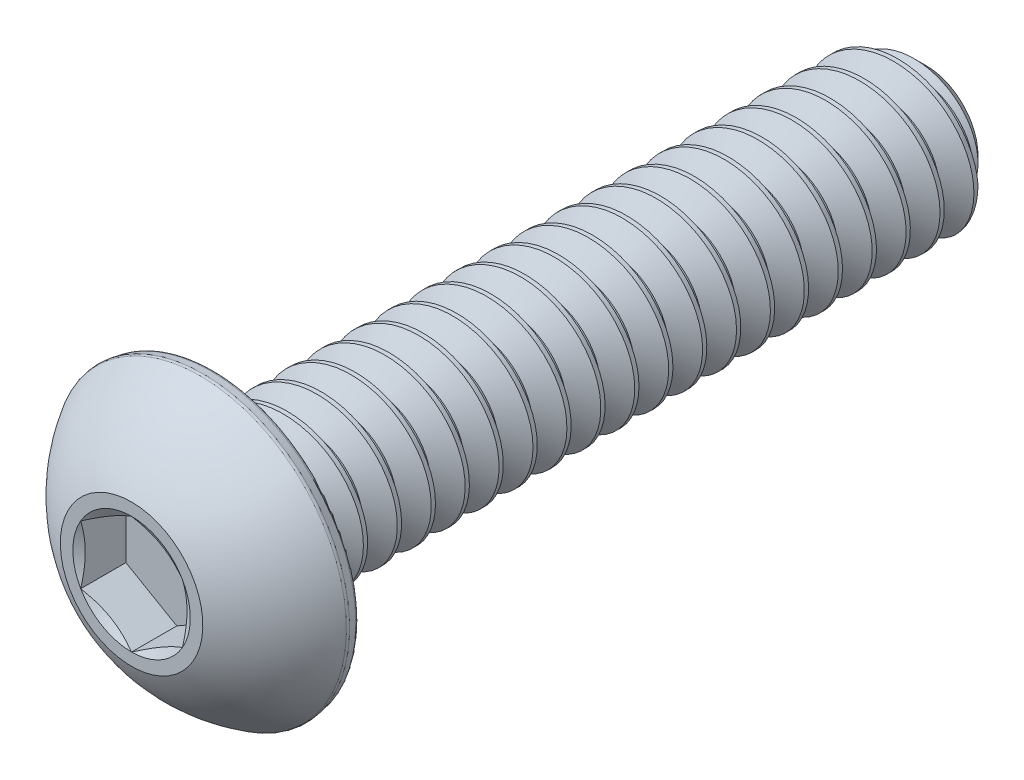
from build123d import *

# Parameters (mm, degrees)
CUT_EXTRUDE1_DEPTH = 1.41097
FILLET1_R          = 0.12827
CUT_SWEEP1_PITCH   = 1.058333333
CUT_SWEEP1_TO      = 22.225


with BuildPart() as part:
    # Sketch3 → Revolve1 (revolve)
    with BuildSketch(Plane(origin=(0, 0, 0), x_dir=(0, 0, -1), z_dir=(1, 0, 0)), mode=Mode.PRIVATE) as revolve1_sk:
        with BuildLine():
            Line((-12.3952, 0), (-12.3952, 2.2225))
            ThreePointArc((-12.3952, 2.2225), (-11.48946038, 3.573966445), (-10.21461, 4.5847))
            Line((-10.21461, 4.5847), (-9.8298, 4.516847615))
            Line((-9.8298, 4.516847615), (-9.8298, 2.413))
            Line((-9.8298, 2.413), (11.60145, 2.413))
            Line((11.60145, 2.413), (12.3952, 1.61925))
            Line((12.3952, 1.61925), (12.3952, 0))
            Line((12.3952, 0), (-12.3952, 0))
        make_face()
    revolve(revolve1_sk.sketch.rotate(Axis((0, 0, 12.3952), (0, 0, -1)), 90), axis=Axis((0, 0, 12.3952), (0, 0, -1)))

    # Sketch4 → Cut-Extrude1 (cut)
    with BuildSketch(Plane.XY.offset(12.3952)):
        Polygon((-1.5875, -0.916543552), (0, -1.833087105), (1.5875, -0.916543552), (1.5875, 0.916543552), (0, 1.833087105), (-1.5875, 0.916543552), align=None)
    extrude(amount=-CUT_EXTRUDE1_DEPTH, mode=Mode.SUBTRACT)

    # Cut-Extrude2 cone 1 section (through the dimple's axis) → Cut-Extrude2 (revolve, cut)
    with BuildSketch(Plane(origin=(0, 0, 12.3952), x_dir=(0, -1, 0), z_dir=(1, 0, 0))):
        Polygon((0, 0), (1.833087105, 0), (0, 1.058333333), align=None)
    revolve(axis=Axis((0, 0, 12.3952), (0, 0, -1)), mode=Mode.SUBTRACT)

    # Fillet1
    fillet1_edges = [part.edges().sort_by_distance(p)[0] for p in [
        (-4.516847615, 0, 9.8298),
        (-4.5847, 0, 10.21461),
    ]]
    fillet(fillet1_edges, radius=FILLET1_R)


with BuildPart() as body_2:
    # Split1: read off the stored shape, not the designer's step
    # Split1: the piece on the far side of the plane
    add(part.part)
    split(bisect_by=Plane.XY.offset(9.8298), keep=Keep.BOTTOM)

    # Cut-Sweep1: arcs per turn and ends read off the stored shape
    # Cut-Sweep1: the profile of Sketch7 screwed along a right-hand helix through 22 turns, 8 arcs to a turn; built about Z, then put on its axis
    cut_sweep1_z = Axis((0, 0, 0), (0, 0, 1))
    cut_sweep1_corners = [(2.470283972, 0, 0.033072917), (2.470283972, 0, -0.959114583), (1.725592336, 0, -0.529166667), (1.725592336, 0, -0.396875)]
    with BuildLine(mode=Mode.PRIVATE) as cut_sweep1_profile:
        Line(cut_sweep1_corners[0], cut_sweep1_corners[1])
        Line(cut_sweep1_corners[1], cut_sweep1_corners[2])
        Line(cut_sweep1_corners[2], cut_sweep1_corners[3])
        Line(cut_sweep1_corners[3], cut_sweep1_corners[0])
    cut_sweep1_cap = Face(cut_sweep1_profile.wire())
    cut_sweep1_turn_angles = [0, 22.5, 45, 67.5, 90, 112.5, 135, 157.5, 180, 202.5, 225, 247.5, 270, 292.5, 315, 337.5, 360]
    cut_sweep1_turn_weights = [1, 0.9238795325112867, 1, 0.9238795325112867, 1, 0.9238795325112867, 1, 0.9238795325112867, 1, 0.9238795325112867, 1, 0.9238795325112867, 1, 0.9238795325112867, 1, 0.9238795325112867, 1]
    cut_sweep1_turn_rails = [Edge.make_bspline([Vector(p[0], p[1], 0).rotate(cut_sweep1_z, cut_sweep1_turn_angles[k]) / cut_sweep1_turn_weights[k] + Vector(0, 0, p[2] + CUT_SWEEP1_PITCH * cut_sweep1_turn_angles[k] / 360) for k in range(17)], [0, 0, 0, 1, 1, 2, 2, 3, 3, 4, 4, 5, 5, 6, 6, 7, 7, 8, 8, 8], 2, cut_sweep1_turn_weights) for p in cut_sweep1_corners]
    cut_sweep1_turn_sides = [Face.make_surface_from_curves(cut_sweep1_turn_rails[p[0]], cut_sweep1_turn_rails[p[1]]) for p in [(0, 1), (1, 2), (2, 3), (3, 0)]]
    cut_sweep1 = Plane(origin=(0, 0, -12.3952), x_dir=(0, 1, 0), z_dir=(0, 0, 1)) * split(Solid(Shell([*[p.moved(Location((0, 0, CUT_SWEEP1_PITCH * i))) for i in range(22) for p in cut_sweep1_turn_sides], cut_sweep1_cap, cut_sweep1_cap.rotate(cut_sweep1_z, 7920).moved(Location((0, 0, CUT_SWEEP1_PITCH * 7920 / 360)))])), bisect_by=Plane.XY.offset(CUT_SWEEP1_TO), keep=Keep.BOTTOM, mode=Mode.PRIVATE)
    add(cut_sweep1, mode=Mode.SUBTRACT)


with BuildPart() as part_1:
    add(part.part)

    # Split1
    split(bisect_by=Plane.XY.offset(9.8298), keep=Keep.TOP)

    add(body_2.part)  # Boss-Extrude1 merges body 2
    # Boss-Extrude1: read off the stored shape, not the designer's step
    # Boss-Extrude1 outline → Boss-Extrude1 (revolve)
    with BuildSketch(Plane.XZ):
        Polygon((1.725588494, 9.8298), (1.725588494, 9.02782055), (2.527567944, 9.8298), align=None)
    revolve(axis=Axis((0, 0, 0), (0, 0, 1)))


solid = part_1.part
